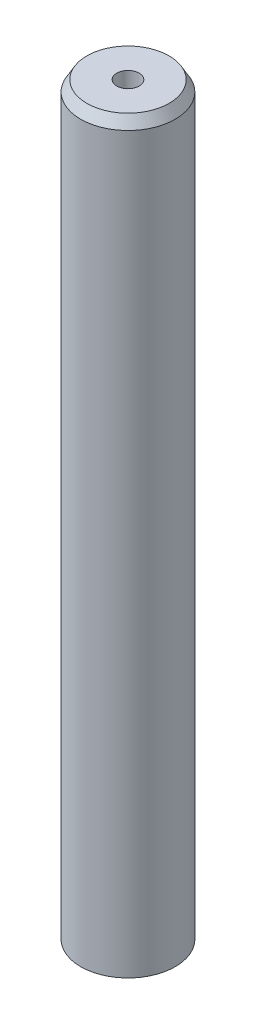
from build123d import *
from OCP.BRepFilletAPI import BRepFilletAPI_MakeChamfer

# Parameters (mm, degrees)
SKETCH1_R           = 5
BOSS_EXTRUDE1_DEPTH = 79.335746321
SKETCH2_R           = 1.185098883
CUT_EXTRUDE1_DEPTH  = 80.650239449
CHAMFER1_SIZE       = 1.126583179
CHAMFER1_SIZE2      = 0.650433102


with BuildPart() as part:
    # Sketch1 → Boss-Extrude1 (new body)
    with BuildSketch(Plane(origin=(0, 0, 0), x_dir=(1, 0, 0), z_dir=(0, 1, 0))):
        Circle(SKETCH1_R)
    extrude(amount=BOSS_EXTRUDE1_DEPTH)

    # Sketch2 → Cut-Extrude1 (cut, through all)
    with BuildSketch(Plane(origin=(0, 0, 0), x_dir=(1, 0, 0), z_dir=(0, 1, 0))):
        Circle(SKETCH2_R)
    extrude(amount=CUT_EXTRUDE1_DEPTH, mode=Mode.SUBTRACT)

    # Chamfer1: one chamfer whose edges measure the first distance from different faces: ONE call of the kernel's chamfer builder (chamfer() names one face for all edges)
    chamfer1_edges_1 = [part.edges().sort_by_distance(p)[0] for p in [
        (-5, 79.335746321, 0),
    ]]
    chamfer1_side_1 = [part.faces().sort_by_distance(p)[0] for p in [
        (-5, 39.66787316, 0),
    ]]
    chamfer1_edges_2 = [part.edges().sort_by_distance(p)[0] for p in [
        (-5, 0, 0),
    ]]
    chamfer1_side_2 = [part.faces().sort_by_distance(p)[0] for p in [
        (-4.858578644, 0, 0),
    ]]
    chamfer1 = BRepFilletAPI_MakeChamfer(part.part.solid().wrapped)
    for e in chamfer1_edges_1:
        chamfer1.Add(CHAMFER1_SIZE, CHAMFER1_SIZE2, e.wrapped, chamfer1_side_1[0].wrapped)  # the first distance lies on this face
    for e in chamfer1_edges_2:
        chamfer1.Add(CHAMFER1_SIZE, CHAMFER1_SIZE2, e.wrapped, chamfer1_side_2[0].wrapped)  # the first distance lies on this face
    add(Compound.cast(chamfer1.Shape()), mode=Mode.REPLACE)


solid = part.part
